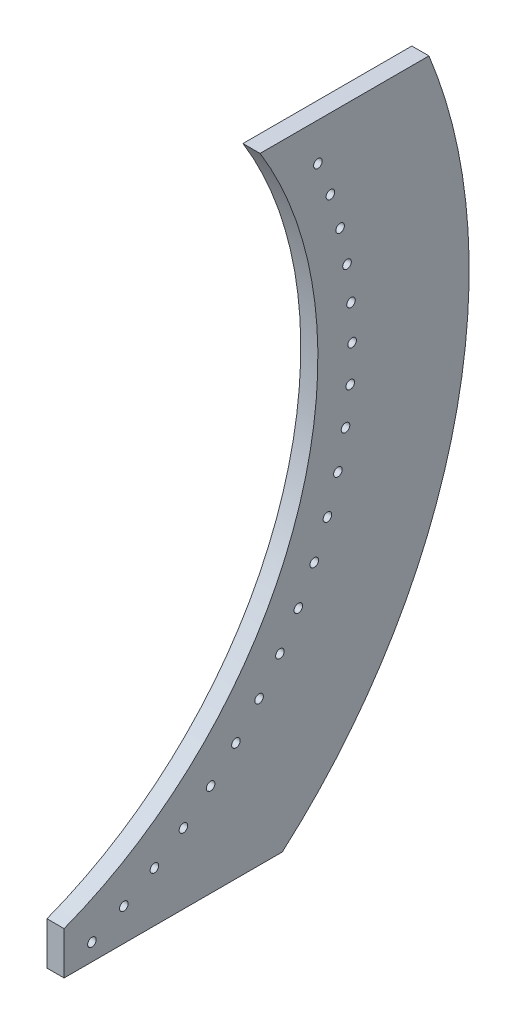
from build123d import *

# Parameters (mm, degrees)
BOSS_EXTRUDE1_DEPTH         = 12.7
SKETCH2_W                   = 323.85
SKETCH2_H                   = 152.4
CUT_EXTRUDE1_DEPTH          = 12.7
F_1_4_0_25_DIAMETER_HOLE2_D = 6.35
CUT_EXTRUDE2_DEPTH          = 561.421227739


with BuildPart() as part:
    # Sketch1 → Boss-Extrude1 (new body)
    with BuildSketch(Plane(origin=(0, 0, 0), x_dir=(0, 0, -1), z_dir=(1, 0, 0))):
        with BuildLine():
            Line((0, 609.6), (323.85, 609.6))
            Line((323.85, 609.6), (323.85, 0))
            Line((323.85, 0), (0, 0))
            Line((0, 0), (0, 31.75))
            ThreePointArc((0, 31.75), (188.340145046, 304.8), (0, 577.85))
            Line((0, 577.85), (0, 609.6))
        make_face()
    extrude(amount=BOSS_EXTRUDE1_DEPTH)

    # Sketch2 → Cut-Extrude1 (cut)
    with BuildSketch(Plane(origin=(12.7, 0, 0), x_dir=(0, 0, -1), z_dir=(1, 0, 0))):
        with Locations((161.925, 533.4)):
            Rectangle(SKETCH2_W, SKETCH2_H)
    extrude(amount=-CUT_EXTRUDE1_DEPTH, mode=Mode.SUBTRACT)

    # 1/4 (0.25) Diameter Hole2 (through all)
    with Locations(Plane(origin=(12.7, 0, 0), x_dir=(0, 0, -1), z_dir=(1, 0, 0))):
        with Locations((20.67422398, 12.7), (44.370645325, 23.973354386), (67.055185152, 37.165039515), (88.57288505, 52.184942803), (108.776757311, 68.93046308), (127.528789002, 87.287211463), (144.70088473, 107.129792746), (160.17574167, 128.32266198), (173.847650859, 150.721050378), (185.623219292, 174.171954236), (195.422007898, 198.515180102), (203.177081014, 223.584439059), (208.835463627, 249.208482649), (212.358503247, 275.212272671), (213.722133941, 301.418176873), (212.917040728, 327.647182356), (209.948723211, 353.720118416), (204.837458009, 379.458880463), (197.618160246, 404.687646654), (188.340145046, 429.234078933)):
            Hole(F_1_4_0_25_DIAMETER_HOLE2_D / 2)

    # Sketch8 → Cut-Extrude2 (cut, through all)
    with BuildSketch(Plane(origin=(12.7, 0, 0), x_dir=(0, 0, -1), z_dir=(1, 0, 0))):
        with BuildLine():
            Line((270.760801555, 457.2), (323.85, 457.2))
            Line((323.85, 457.2), (323.85, 0))
            Line((323.85, 0), (161.925, 0))
            ThreePointArc((161.925, 0), (289.589524386, 211.163746738), (270.760801555, 457.2))
        make_face()
    extrude(amount=-CUT_EXTRUDE2_DEPTH, mode=Mode.SUBTRACT)


solid = part.part
